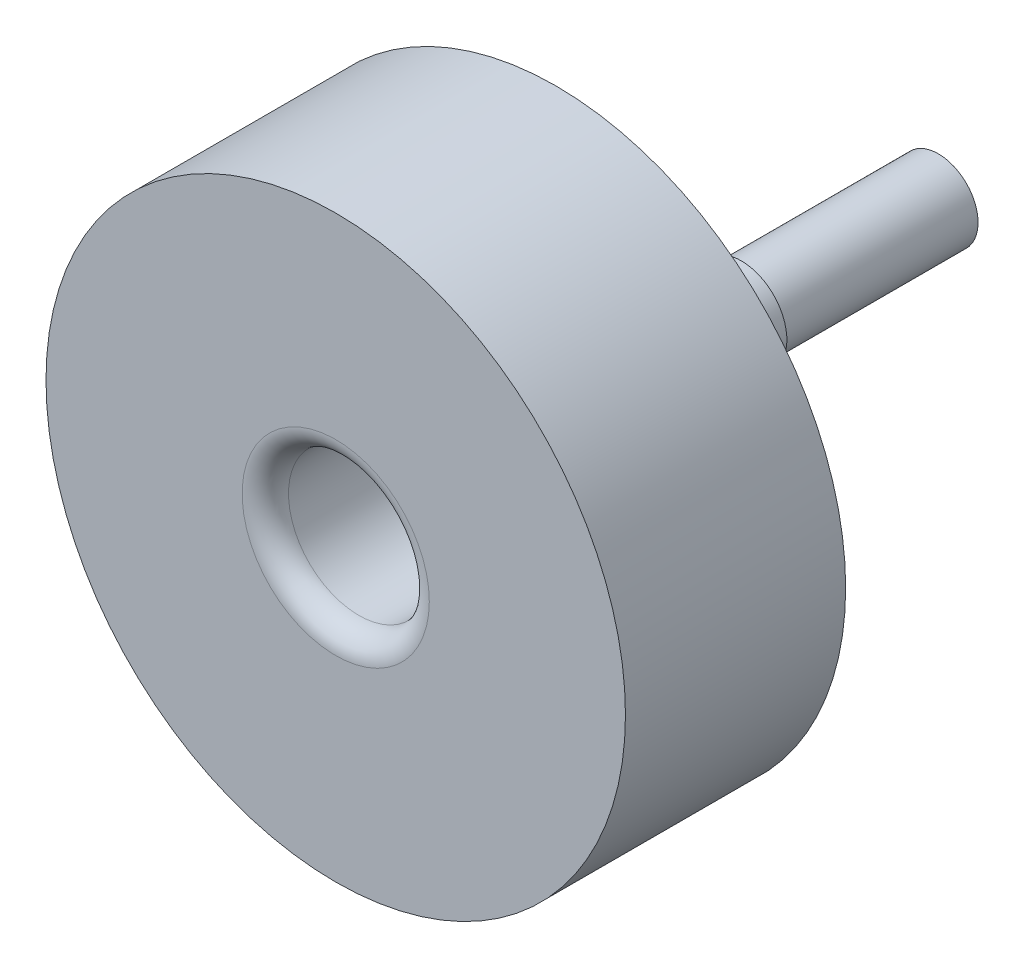
from build123d import *

# Parameters (mm, degrees)
SKIZZE1_R                       = 6
AUFSATZ_LINEAR_AUSTRAGEN1_DEPTH = 9
SKIZZE2_R                       = 3.925
AUFSATZ_LINEAR_AUSTRAGEN2_DEPTH = 7
SKIZZE3_R                       = 25
AUFSATZ_LINEAR_AUSTRAGEN3_DEPTH = 19
SKIZZE4_R                       = 6.075
SCHNITT_LINEAR_AUSTRAGEN2_DEPTH = 10
VERRUNDUNG1_R                   = 2
SKIZZE5_R                       = 3.425
AUFSATZ_LINEAR_AUSTRAGEN4_DEPTH = 17


with BuildPart() as part:
    # Skizze1 → Aufsatz-Linear austragen1 (new body)
    with BuildSketch(Plane.XY):
        Circle(SKIZZE1_R)
    extrude(amount=AUFSATZ_LINEAR_AUSTRAGEN1_DEPTH)

    # Skizze2 → Aufsatz-Linear austragen2 (add)
    with BuildSketch(Plane(origin=(0, 0, 0), x_dir=(-1, 0, 0), z_dir=(0, 0, -1))):
        Circle(SKIZZE2_R)
    extrude(amount=AUFSATZ_LINEAR_AUSTRAGEN2_DEPTH)

    # Skizze3 → Aufsatz-Linear austragen3 (add)
    with BuildSketch(Plane.XY.offset(9)):
        Circle(SKIZZE3_R)
    extrude(amount=AUFSATZ_LINEAR_AUSTRAGEN3_DEPTH)

    # Skizze4 → Schnitt-Linear austragen2 (cut)
    with BuildSketch(Plane.XY.offset(28)):
        Circle(SKIZZE4_R)
    extrude(amount=-SCHNITT_LINEAR_AUSTRAGEN2_DEPTH, mode=Mode.SUBTRACT)

    # Verrundung1
    verrundung1_edges = [part.edges().sort_by_distance(p)[0] for p in [
        (-6.075, 0, 28),
    ]]
    fillet(verrundung1_edges, radius=VERRUNDUNG1_R)

    # Skizze5 → Aufsatz-Linear austragen4 (add)
    with BuildSketch(Plane(origin=(0, 0, -7), x_dir=(-1, 0, 0), z_dir=(0, 0, -1))):
        Circle(SKIZZE5_R)
    extrude(amount=AUFSATZ_LINEAR_AUSTRAGEN4_DEPTH)


solid = part.part
